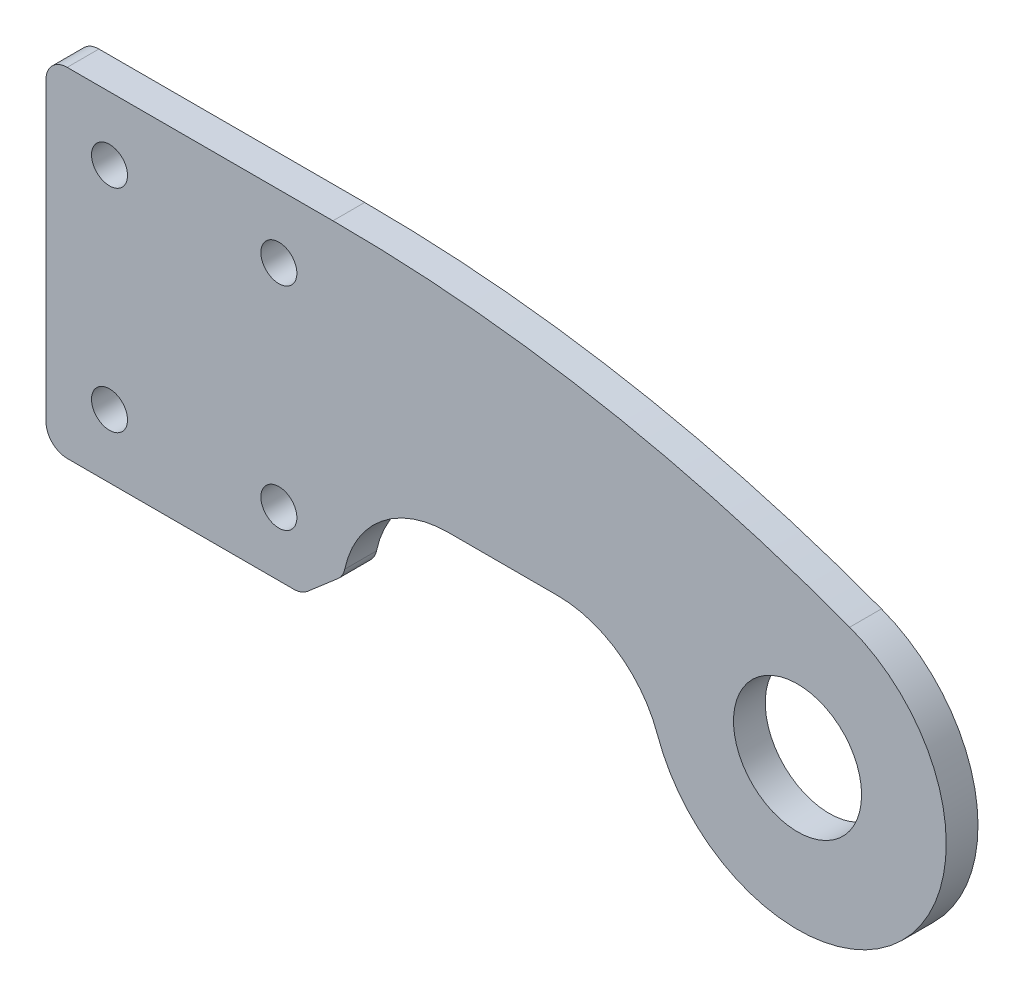
from build123d import *

# Parameters (mm, degrees)
ESQUISSE1_R          = 3.025
ESQUISSE1_R_2        = 0.85
BOSS_EXTRU_1_DEPTH   = 0.75
CONG_1_R             = 5
CONG_2_R             = 1
CHANFREIN1_START     = -11.517439791
CHANFREIN1_OUTLINE_W = 6
CHANFREIN1_OUTLINE_H = 4
CHANFREIN1_DEPTH     = 2.517439791
CONG_3_R             = 1
BOSS_EXTRU_2_DEPTH   = 1.5


with BuildPart() as part:
    # Esquisse1 → Boss.-Extru.1 (new, symmetric)
    with BuildSketch(Plane.XY):
        with BuildLine():
            Line((-21.5, 11), (1.242174044, 6.914306086))
            ThreePointArc((1.242174044, 6.914306086), (4.121125954, -5.689195538), (-6.957010852, 0.975))
            Line((-6.957010852, 0.975), (-21.5, 0.975))
            Line((-21.5, 0.975), (-21.5, -5))
            Line((-21.5, -5), (-35.5, -5))
            Line((-35.5, -5), (-35.5, 11))
            Line((-35.5, 11), (-21.5, 11))
        make_face()
        Circle(ESQUISSE1_R, mode=Mode.SUBTRACT)
        with Locations((-32.5, 8)):
            Circle(ESQUISSE1_R_2, mode=Mode.SUBTRACT)
        with Locations((-24.5, 8)):
            Circle(ESQUISSE1_R_2, mode=Mode.SUBTRACT)
        with Locations((-24.5, -2)):
            Circle(ESQUISSE1_R_2, mode=Mode.SUBTRACT)
        with Locations((-32.5, -2)):
            Circle(ESQUISSE1_R_2, mode=Mode.SUBTRACT)
    extrude(amount=BOSS_EXTRU_1_DEPTH, both=True)

    # Congé1
    cong_1_edges = [part.edges().sort_by_distance(p)[0] for p in [
        (-21.5, 11, 0),
        (-6.957010852, 0.975, 0),
        (-21.5, 0.975, 0),
    ]]
    fillet(cong_1_edges, radius=CONG_1_R)

    # Congé2
    cong_2_edges = [part.edges().sort_by_distance(p)[0] for p in [
        (-35.5, 11, 0),
        (-35.5, -5, 0),
    ]]
    fillet(cong_2_edges, radius=CONG_2_R)

    # Chanfrein1: read off the stored shape, not the designer's step
    # Chanfrein1 outline → Chanfrein1 (cut)
    with BuildSketch(Plane(origin=(0, 0, 0), x_dir=(0.7571091636707948, 0.6532883852371091, 0), z_dir=(0.6532883852371091, -0.7571091636707951, 0)).offset(CHANFREIN1_START)):
        with Locations((-20, 0)):
            Rectangle(CHANFREIN1_OUTLINE_W, CHANFREIN1_OUTLINE_H)
    extrude(amount=CHANFREIN1_DEPTH, mode=Mode.SUBTRACT)

    # Congé3
    cong_3_edges = [part.edges().sort_by_distance(p)[0] for p in [
        (-21.44610623, -3.292857143, 0),
        (-23.424548722, -5, 0),
    ]]
    fillet(cong_3_edges, radius=CONG_3_R)

    # Esquisse2 → Boss.-Extru.2 (add)
    with BuildSketch(Plane.XY.offset(0.75)):
        with BuildLine():
            Line((-21.945565237, 11), (2.464036076, 6.578689171))
            ThreePointArc((2.464036076, 6.578689171), (-9.542172297, 9.885752111), (-21.945565237, 11))
        make_face()
    extrude(amount=-BOSS_EXTRU_2_DEPTH)


solid = part.part
